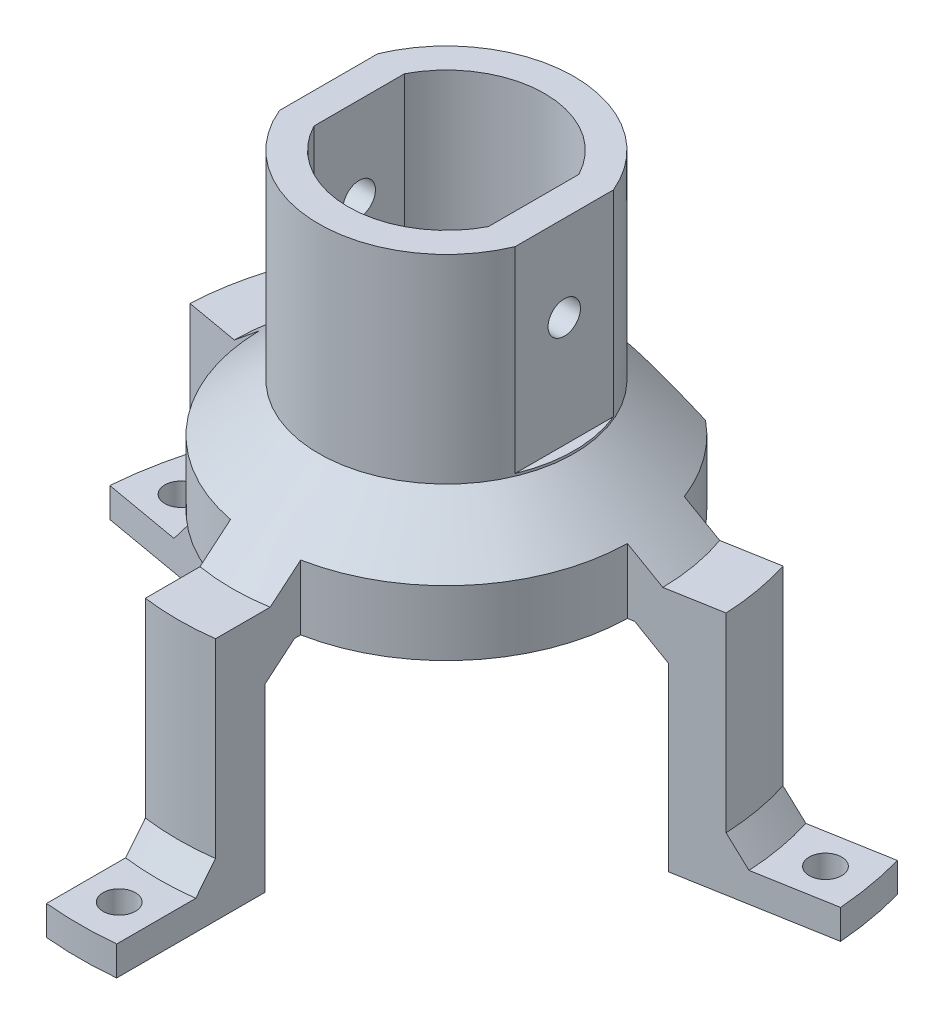
from build123d import *

# Parameters (mm, degrees)
SKETCH4_R               = 3.3
CUT_EXTRUDE1_DEPTH      = 150.054834173
BOSS_EXTRUDE1_REACH     = 150.939
CUT_EXTRUDE2_START      = -40
CUT_EXTRUDE2_DEPTH      = 40
SKETCH7_R               = 3.3
CUT_EXTRUDE3_DEPTH      = 145.007530146
CUT_EXTRUDE4_DEPTH      = 129.807002677
CUT_EXTRUDE4_DEPTH_BACK = 129.807002677


with BuildPart() as part:
    # Sketch3 → Revolve1 (revolve)
    with BuildSketch(Plane.XY):
        Polygon((7, 10.58), (7, 14.08), (20, 14.08), (20, 74.08), (26, 74.08), (26, 33.58), (43.625, 18.58), (54.625, 18.58), (54.625, -20.1795), (58.625, -25.1795), (74.625, -25.1795), (74.625, -31.1795), (44.625, -31.1795), (44.625, 5.58), (38.75, 10.58), align=None)
    revolve(axis=Axis((0, -36.773543234, 0), (0, 1, 0)))

    # Sketch4 → Cut-Extrude1 (cut, through all)
    with BuildSketch(Plane(origin=(0, 74.08, 0), x_dir=(1, 0, 0), z_dir=(0, 1, 0))):
        with BuildLine():
            ThreePointArc((-74.394266671, 5.863762566), (-57.166066568, -47.968025373), (-7.14375, -74.282282281))
            Line((-7.14375, -74.282282281), (-7.14375, -36.813269835))
            ThreePointArc((-7.14375, -36.813269835), (-28.726666617, -24.104535363), (-37.494492716, -0.642663165))
            Line((-37.494492716, -0.642663165), (-74.394266671, 5.863762566))
        make_face()
        with BuildLine():
            Line((7.14375, -36.813269835), (7.14375, -74.282282281))
            ThreePointArc((7.14375, -74.282282281), (57.166066568, -47.968025373), (74.394266671, 5.863762565))
            Line((74.394266671, 5.863762565), (37.494492716, -0.642663165))
            ThreePointArc((37.494492716, -0.642663165), (28.726666617, -24.104535363), (7.14375, -36.813269835))
        make_face()
        with BuildLine():
            ThreePointArc((71.913268333, 19.934203337), (0, 74.625), (-71.913268333, 19.934203337))
            Line((-71.913268333, 19.934203337), (-35.013494378, 13.427777606))
            ThreePointArc((-35.013494378, 13.427777606), (0, 37.5), (35.013494378, 13.427777606))
            Line((35.013494378, 13.427777606), (71.913268333, 19.934203337))
        make_face()
        with Locations((-65.612816544, 11.569309837)):
            Circle(SKETCH4_R)
        with Locations((0, -66.625)):
            Circle(SKETCH4_R)
        with Locations((65.612816544, 11.569309837)):
            Circle(SKETCH4_R)
    extrude(amount=-CUT_EXTRUDE1_DEPTH, mode=Mode.SUBTRACT)

    # Sketch5 → Boss-Extrude1 (add, up to next)
    with BuildSketch(Plane(origin=(0, 74.08, 0), x_dir=(1, 0, 0), z_dir=(0, 1, 0)), mode=Mode.PRIVATE) as boss_extrude1_sk1:
        with BuildLine():
            Line((-17.75, -9.216154296), (-17.75, 9.216154296))
            ThreePointArc((-17.75, 9.216154296), (-20, 0), (-17.75, -9.216154296))
        make_face()
    boss_extrude1_tool1 = extrude(boss_extrude1_sk1.sketch, amount=-BOSS_EXTRUDE1_REACH, mode=Mode.PRIVATE) - part.part
    # Sketch5 → Boss-Extrude1 (add, up to next)
    with BuildSketch(Plane(origin=(0, 74.08, 0), x_dir=(1, 0, 0), z_dir=(0, 1, 0)), mode=Mode.PRIVATE) as boss_extrude1_sk2:
        with BuildLine():
            Line((17.75, -9.216154296), (17.75, 9.216154296))
            ThreePointArc((17.75, 9.216154296), (20, 0), (17.75, -9.216154296))
        make_face()
    boss_extrude1_tool2 = extrude(boss_extrude1_sk2.sketch, amount=-BOSS_EXTRUDE1_REACH, mode=Mode.PRIVATE) - part.part
    add(boss_extrude1_tool1.solids().sort_by_distance((-18.654485, 74.08, 0))[0])
    add(boss_extrude1_tool2.solids().sort_by_distance((18.654485, 74.08, 0))[0])

    # Sketch6 → Cut-Extrude2 (cut)
    with BuildSketch(Plane(origin=(0, 74.08, 0), x_dir=(1, 0, 0), z_dir=(0, 1, 0)).offset(CUT_EXTRUDE2_START)):
        with BuildLine():
            Line((-24, 10), (-24, -10))
            ThreePointArc((-24, -10), (-26, 0), (-24, 10))
        make_face()
        with BuildLine():
            Line((24, 10), (24, -10))
            ThreePointArc((24, -10), (26, 0), (24, 10))
        make_face()
    extrude(amount=CUT_EXTRUDE2_DEPTH, mode=Mode.SUBTRACT)

    # Sketch7 → Cut-Extrude3 (cut, through all)
    with BuildSketch(Plane(origin=(24, 0, 0), x_dir=(0, 0, -1), z_dir=(1, 0, 0))):
        with Locations((0, 56.58)):
            Circle(SKETCH7_R)
    extrude(amount=-CUT_EXTRUDE3_DEPTH, mode=Mode.SUBTRACT)

    # Sketch8 → Cut-Extrude4 (cut, two sides: drawn at the far end of the back side and taken through both)
    with BuildSketch(Plane(origin=(0, 0, 0), x_dir=(1, 0, 0), z_dir=(0, 1, 0)).offset(-CUT_EXTRUDE4_DEPTH_BACK)):
        with BuildLine():
            Line((73.217938982, 47.13394512), (-64.465967913, 47.13394512))
            ThreePointArc((-64.465967913, 47.13394512), (4.375985534, 27.602317156), (73.217938982, 47.13394512))
        make_face()
    extrude(amount=CUT_EXTRUDE4_DEPTH + CUT_EXTRUDE4_DEPTH_BACK, mode=Mode.SUBTRACT)


solid = part.part
